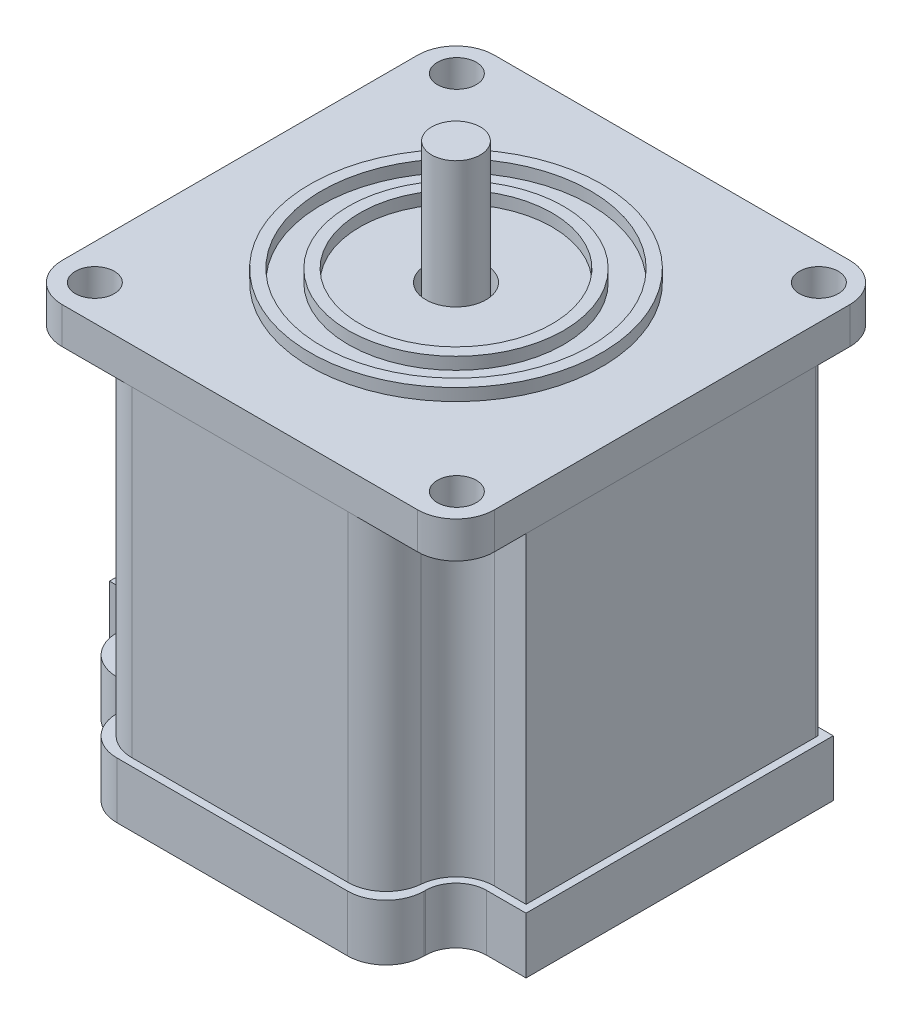
from build123d import *

# Parameters (mm, degrees)
SKETCH1_W            = 56.4
SKETCH1_H            = 56.4
BOSS_EXTRUDE1_DEPTH  = 27
SKETCH2_R            = 19.05
SKETCH2_R_2          = 17.55
SKETCH2_R_3          = 14.05
SKETCH2_R_4          = 12.55
BOSS_EXTRUDE2_DEPTH  = 1.59
CUT_EXTRUDE1_DEPTH   = 49.24
LPATTERN2_COUNT      = 2
LPATTERN2_PITCH      = 47.25
LPATTERN2_COUNT_DIR2 = 2
LPATTERN2_PITCH_DIR2 = 47.25
SKETCH5_R            = 2.5400000000000027
CUT_EXTRUDE3_DEPTH   = 11.24
LPATTERN3_COUNT      = 2
LPATTERN3_PITCH      = 47.25
LPATTERN3_COUNT_DIR2 = 2
LPATTERN3_PITCH_DIR2 = 47.25
SKETCH6_R            = 3.175
BOSS_EXTRUDE3_DEPTH  = 16
CUT_EXTRUDE4_START   = -8
SKETCH8_R            = 3.925
SKETCH8_R_2          = 3.175
CUT_EXTRUDE4_DEPTH   = 8
FILLET2_R            = 5
BOSS_EXTRUDE5_DEPTH  = 7.33
CUT_EXTRUDE7_DEPTH   = 1
BOSS_EXTRUDE6_START  = -7.33
SKETCH19_W           = 1
SKETCH19_H           = 19.399999999999995
BOSS_EXTRUDE6_DEPTH  = 7.33
FILLET3_R            = 5
FILLET4_R            = 5
FILLET5_R            = 5
FILLET6_R            = 5
FILLET7_R            = 5
FILLET8_R            = 5
FILLET10_R           = 5
FILLET11_R           = 5
FILLET12_R           = 5
FILLET13_R           = 5
FILLET14_R           = 5
FILLET15_R           = 5


with BuildPart() as part:
    # Sketch1 → Boss-Extrude1 (new, symmetric)
    with BuildSketch(Plane(origin=(0, 0, 0), x_dir=(1, 0, 0), z_dir=(0, 1, 0))):
        Rectangle(SKETCH1_W, SKETCH1_H)
    extrude(amount=BOSS_EXTRUDE1_DEPTH, both=True)

    # Sketch2 → Boss-Extrude2 (add)
    # profile 1 of 2: a face of its own
    with BuildSketch(Plane(origin=(0, 27, 0), x_dir=(1, 0, 0), z_dir=(0, 1, 0))):
        with Locations(Location((0, 0, 0), (0, 0, 90))):
            Circle(SKETCH2_R)
        with Locations(Location((0, 0, 0), (0, 0, 90))):
            Circle(SKETCH2_R_2, mode=Mode.SUBTRACT)
    # profile 2 of 2: a face of its own
    with BuildSketch(Plane(origin=(0, 27, 0), x_dir=(1, 0, 0), z_dir=(0, 1, 0))):
        with Locations(Location((0, 0, 0), (0, 0, 90))):
            Circle(SKETCH2_R_3)
        with Locations(Location((0, 0, 0), (0, 0, 90))):
            Circle(SKETCH2_R_4, mode=Mode.SUBTRACT)
    extrude(amount=BOSS_EXTRUDE2_DEPTH)

    # Sketch3 → Cut-Extrude1 (cut)
    with BuildSketch(Plane.XZ.offset(27)):
        Polygon((-28.200000000000006, 28.200000000000003), (-19.060000000000006, 28.200000000000003), (-19.060000000000013, 19.050000000000004), (-28.200000000000014, 19.050000000000004), align=None)
    cut_extrude1 = extrude(amount=-CUT_EXTRUDE1_DEPTH, mode=Mode.SUBTRACT)

    # LPattern2: Cut-Extrude1 2 × 2
    with Locations(*[(i * LPATTERN2_PITCH, 0, -j * LPATTERN2_PITCH_DIR2) for i in range(LPATTERN2_COUNT) for j in range(LPATTERN2_COUNT_DIR2) if (i, j) != (0, 0)]):
        add(cut_extrude1, mode=Mode.SUBTRACT)

    # Sketch5 → Cut-Extrude3 (cut)
    with BuildSketch(Plane(origin=(0, 27, 0), x_dir=(1, 0, 0), z_dir=(0, 1, 0))):
        with Locations(Location((-23.57, -23.57, 0), (0, 0, 270))):
            Circle(SKETCH5_R)
    cut_extrude3 = extrude(amount=-CUT_EXTRUDE3_DEPTH, mode=Mode.SUBTRACT)

    # LPattern3: Cut-Extrude3 2 × 2
    with Locations(*[(i * LPATTERN3_PITCH, 0, -j * LPATTERN3_PITCH_DIR2) for i in range(LPATTERN3_COUNT) for j in range(LPATTERN3_COUNT_DIR2) if (i, j) != (0, 0)]):
        add(cut_extrude3, mode=Mode.SUBTRACT)

    # Sketch6 → Boss-Extrude3 (add)
    with BuildSketch(Plane(origin=(0, 27, 0), x_dir=(1, 0, 0), z_dir=(0, 1, 0))):
        with Locations(Location((0, 0, 0), (0, 0, 90))):
            Circle(SKETCH6_R)
    extrude(amount=BOSS_EXTRUDE3_DEPTH)

    # Sketch8 → Cut-Extrude4 (cut)
    with BuildSketch(Plane(origin=(0, 27, 0), x_dir=(1, 0, 0), z_dir=(0, 1, 0)).offset(CUT_EXTRUDE4_START)):
        with Locations(Location((0, 0, 0), (0, 0, 270))):
            Circle(SKETCH8_R)
        with Locations(Location((0, 0, 0), (0, 0, 270))):
            Circle(SKETCH8_R_2, mode=Mode.SUBTRACT)
    extrude(amount=CUT_EXTRUDE4_DEPTH, mode=Mode.SUBTRACT)

    # Fillet2
    fillet2_edges = [part.edges().sort_by_distance(p)[0] for p in [
        (-19.060000000000013, -2.379999999999999, 19.050000000000004),
        (-19.060000000000006, -2.379999999999999, -19.049999999999997),
        (19.049999999999986, -2.379999999999999, 19.050000000000004),
        (19.049999999999994, -2.379999999999999, -19.049999999999997),
    ]]
    fillet(fillet2_edges, radius=FILLET2_R)

    # Sketch9 → Boss-Extrude5 (add)
    with BuildSketch(Plane.ZY.offset(28.200000000000006)):
        Polygon((-9.699999999999996, -27.000000000000014), (9.7, -27.00000000000001), (9.700000000000003, -19.67), (-9.699999999999996, -19.670000000000005), align=None)
    extrude(amount=BOSS_EXTRUDE5_DEPTH)

    # Sketch17 → Cut-Extrude7 (cut)
    with BuildSketch(Plane(origin=(28.199999999999992, 0, 0), x_dir=(0, 0, -1), z_dir=(1, 0, 0))):
        Polygon((-28.200000000000003, -27), (-19.060000000000002, -27), (-19.060000000000002, 22.24), (-28.200000000000017, 22.24), align=None)
        Polygon((28.199999999999996, -27), (19.059999999999988, -27), (19.05999999999999, 22.24), (28.19999999999999, 22.24), align=None)
    extrude(amount=-CUT_EXTRUDE7_DEPTH, mode=Mode.SUBTRACT)

    # Sketch19 → Boss-Extrude6 (add)
    with BuildSketch(Plane.XZ.offset(27).offset(BOSS_EXTRUDE6_START)):
        with BuildLine():
            Line((-28.200000000000006, 9.700000000000001), (-28.200000000000014, 19.050000000000004))
            Line((-28.200000000000014, 19.050000000000004), (-24.060000000000013, 19.050000000000004))
            ThreePointArc((-24.060000000000013, 19.050000000000004), (-20.524466094067275, 20.514466094067267), (-19.060000000000006, 24.05))
            Line((-19.06000000000001, 24.05), (-19.060000000000006, 28.200000000000003))
            Line((-19.060000000000006, 28.200000000000003), (19.049999999999994, 28.200000000000003))
            Line((19.049999999999994, 28.200000000000003), (19.04999999999999, 24.050000000000008))
            ThreePointArc((19.04999999999999, 24.050000000000008), (20.514466094067252, 20.51446609406727), (24.04999999999999, 19.050000000000004))
            Line((24.04999999999999, 19.050000000000004), (28.189999999999987, 19.050000000000004))
            Line((28.189999999999987, 19.050000000000004), (28.18999999999999, 19.060000000000002))
            Line((28.18999999999999, 19.060000000000002), (28.199999999999992, 19.060000000000002))
            Line((28.199999999999992, 19.060000000000002), (28.199999999999992, -19.059999999999988))
            Line((28.199999999999992, -19.059999999999988), (28.19, -19.059999999999988))
            Line((28.19, -19.059999999999988), (28.19, -19.049999999999997))
            Line((28.19, -19.049999999999997), (24.049999999999997, -19.049999999999997))
            ThreePointArc((24.049999999999997, -19.049999999999997), (20.51446609406726, -20.51446609406726), (19.049999999999997, -24.049999999999994))
            Line((19.049999999999997, -24.049999999999994), (19.049999999999994, -28.199999999999996))
            Line((19.049999999999994, -28.199999999999996), (-19.060000000000006, -28.199999999999996))
            Line((-19.060000000000006, -28.199999999999996), (-19.060000000000002, -24.05))
            ThreePointArc((-19.060000000000002, -24.05), (-20.524466094067265, -20.51446609406726), (-24.060000000000006, -19.049999999999997))
            Line((-24.060000000000006, -19.049999999999997), (-28.2, -19.049999999999997))
            Line((-28.2, -19.049999999999997), (-28.200000000000006, -9.699999999999994))
            Line((-28.200000000000006, -9.699999999999994), (-29.200000000000006, -9.699999999999994))
            Line((-29.200000000000006, -9.699999999999994), (-29.2, -20.049999999999997))
            Line((-29.2, -20.049999999999997), (-24.060000000000006, -20.049999999999997))
            ThreePointArc((-24.060000000000006, -20.049999999999997), (-21.231572875253814, -21.22157287525381), (-20.060000000000006, -24.05))
            Line((-20.060000000000006, -24.05), (-20.060000000000013, -29.199999999999996))
            Line((-20.060000000000016, -29.199999999999996), (20.049999999999997, -29.199999999999996))
            Line((20.049999999999997, -29.199999999999996), (20.049999999999997, -24.049999999999994))
            ThreePointArc((20.049999999999997, -24.049999999999994), (21.22157287525381, -21.221572875253806), (24.049999999999997, -20.049999999999997))
            Line((24.049999999999997, -20.049999999999997), (29.189999999999987, -20.049999999999997))
            Line((29.189999999999987, -20.049999999999997), (29.189999999999994, 20.050000000000004))
            Line((29.189999999999994, 20.050000000000004), (24.04999999999999, 20.050000000000004))
            ThreePointArc((24.04999999999999, 20.050000000000004), (21.2215728752538, 21.221572875253816), (20.04999999999999, 24.050000000000008))
            Line((20.04999999999999, 24.050000000000008), (20.049999999999986, 29.200000000000006))
            Line((20.049999999999986, 29.200000000000006), (-20.060000000000006, 29.200000000000003))
            Line((-20.060000000000006, 29.200000000000003), (-20.060000000000006, 24.05))
            ThreePointArc((-20.060000000000006, 24.05), (-21.23157287525382, 21.221572875253813), (-24.060000000000013, 20.050000000000004))
            Line((-24.060000000000013, 20.050000000000004), (-29.200000000000014, 20.050000000000004))
            Line((-29.200000000000014, 20.050000000000004), (-29.200000000000006, 9.700000000000001))
            Line((-29.200000000000006, 9.700000000000001), (-28.200000000000006, 9.700000000000001))
        make_face()
        with Locations((-28.700000000000006, 3.55e-15)):
            Rectangle(SKETCH19_W, SKETCH19_H)
    extrude(amount=BOSS_EXTRUDE6_DEPTH)

    # Fillet3
    fillet3_edges = [part.edges().sort_by_distance(p)[0] for p in [
        (28.199999999999992, 24.619999999999997, 28.200000000000003),
        (-28.200000000000006, 24.62, 28.200000000000003),
        (-28.200000000000006, 24.62, -28.199999999999996),
        (28.199999999999992, 24.619999999999997, -28.199999999999996),
    ]]
    fillet(fillet3_edges, radius=FILLET3_R)

    # Fillet4
    # the kernel refuses this fillet: 5 mm, written as the material it takes off along each edge
    with BuildSketch(Plane(origin=(28.189999999999987, 22.239999999999995, 19.060000000000002), x_dir=(-7.1e-16, 0, -1), z_dir=(0, -1, 0))) as fillet4_piece_1_section:
        with BuildLine():
            CenterArc((FILLET4_R, FILLET4_R), FILLET4_R, 180.00000000000003, 90)
            Line((-3.55e-15, FILLET4_R), (0, 0))
            Line((0, 0), (FILLET4_R, 0))
        make_face()
    fillet4_piece_1 = extrude(amount=41.91, mode=Mode.PRIVATE)
    fillet4_piece_1 = split(fillet4_piece_1, bisect_by=Plane(origin=(28.194999999999993, 1.2849999999999966, 19.050000000000004), z_dir=(0, 0, 1)), keep=Keep.TOP, mode=Mode.PRIVATE)
    add(fillet4_piece_1, mode=Mode.SUBTRACT)
    with BuildSketch(Plane(origin=(19.049999999999994, -19.67, 28.200000000000003), x_dir=(-1, 0, 0), z_dir=(0, 1, 0))) as fillet4_piece_2:
        with BuildLine():
            CenterArc((4.96380951243048, -5), FILLET4_R, 90, 85.12397513038704)
            Line((-0.01809524378475658, -4.574999999999999), (-0.5162857194062802, -4.532499999999999))
            ThreePointArc((-0.5162857194062802, -4.532499999999999), (-0.49999999999999645, -4.149999999999995), (-0.5, 0))
            Line((-0.5, 0), (0, 0.5))
            Line((0, 0.5), (4.96380951243048, 0.5))
            Line((4.96380951243048, 0.5), (4.96380951243048, 0))
        make_face()
    extrude(amount=41.910000000000004, mode=Mode.SUBTRACT)
    with BuildSketch(Plane(origin=(-19.060000000000006, -19.67, 28.200000000000003), x_dir=(1, 0, 0), z_dir=(0, 1, 0))) as fillet4_piece_3:
        with BuildLine():
            CenterArc((4.963809512430471, 5), FILLET4_R, 184.87602486961296, 85.12397513038707)
            Line((-0.01809524378476723, 4.574999999999999), (-0.5162857194062909, 4.532499999999999))
            ThreePointArc((-0.5162857194062909, 4.532499999999999), (-0.5000000000000036, 4.150000000000002), (-0.5, 0))
            Line((-0.5, 0), (0, -0.5))
            Line((0, -0.5), (4.963809512430471, -0.5))
            Line((4.963809512430471, -0.5), (4.963809512430471, 0))
        make_face()
    extrude(amount=41.910000000000004, mode=Mode.SUBTRACT)
    with BuildSketch(Plane(origin=(-28.200000000000014, -19.67, 19.050000000000004), x_dir=(1.43e-15, 0, -1), z_dir=(0, 1, 0))) as fillet4_piece_4:
        with BuildLine():
            CenterArc((4.962951369950581, -5), FILLET4_R, 90.00000000000009, 85.06646876992886)
            Line((-0.01852431502470665, -4.570000000000004), (-0.5166718835222361, -4.5270000000000055))
            ThreePointArc((-0.5166718835222361, -4.5270000000000055), (-0.49999999999999406, -4.1400000000000015), (-0.5, -7.2e-16))
            Line((-0.5, -7.2e-16), (-7.2e-16, 0.5))
            Line((-7.2e-16, 0.5), (4.962951369950573, 0.5))
            Line((4.962951369950573, 0.5), (4.962951369950574, 0))
        make_face()
    extrude(amount=41.910000000000004, mode=Mode.SUBTRACT)

    # Fillet5
    # the kernel refuses this fillet: 5 mm, written as the material it takes off along each edge
    with BuildSketch(Plane(origin=(19.049999999999986, -19.67, -28.199999999999996), x_dir=(0.003955213605638994, 0, 0.999992178112076), z_dir=(0, 1, 0))) as fillet5_piece_1:
        with BuildLine():
            CenterArc((4.980327963641015, -4.983546754096982), FILLET5_R, 94.64940723207758, 85.12397513038707)
            Line((-0.01963292691936526, -4.963770686068789), (-0.5196290159754032, -4.961793079265969))
            Line((-0.5196290159754032, -4.961793079265969), (-0.499996089056038, 0.0019776068028195))
            Line((-0.499996089056038, 0.0019776068028195), (0.0019776068028195, 0.499996089056038))
            ThreePointArc((0.0019776068028195, 0.499996089056038), (4.151945145967937, 0.4835819525926397), (4.534506567594776, 0.4983546754096982))
            Line((4.534506567594776, 0.4983546754096982), (4.575035785417161, 0))
        make_face()
    extrude(amount=41.910000000000004, mode=Mode.SUBTRACT)

    # Fillet6
    # the kernel refuses this fillet: 5 mm, written as the material it takes off along each edge
    with BuildSketch(Plane(origin=(28.199999999999992, -19.67, -19.059999999999988), x_dir=(-1, 0, 0), z_dir=(0, 1, -7e-17))) as fillet6_piece_1:
        with BuildLine():
            CenterArc((5, 0.3160696125855509), FILLET6_R, 180, 3.624307494007553)
            Line((0, 0.3160696125855509), (0, 0))
            Line((0, 0), (0.00999999999999801, 0))
        make_face()
    extrude(amount=41.91, mode=Mode.SUBTRACT)

    # Fillet7
    # the kernel refuses this fillet: 5 mm, written as the material it takes off along each edge
    with BuildSketch(Plane(origin=(-28.200000000000006, -19.67, -19.049999999999997), x_dir=(0.9999917848297434, 0, -0.004053427318230063), z_dir=(0, 1, 0))) as fillet7_piece_1:
        with BuildLine():
            CenterArc((4.979841961486708, -4.983177735051244), FILLET7_R, 94.70128631619599, 85.06646876992889)
            Line((-0.02011696266200852, -4.962910598460094), (-0.5201128550768802, -4.960883884800979))
            Line((-0.5201128550768802, -4.960883884800979), (-0.4999958924148717, 0.00202671365911503))
            Line((-0.4999958924148717, 0.00202671365911503), (0.00202671365911503, 0.4999958924148717))
            ThreePointArc((0.00202671365911503, 0.4999958924148717), (4.141992702854253, 0.48321470331739924), (4.5290571018514765, 0.49831777350512513))
            Line((4.5290571018514765, 0.49831777350512513), (4.570037543636496, 0))
        make_face()
    extrude(amount=41.910000000000004, mode=Mode.SUBTRACT)

    # Fillet8
    # the kernel refuses this fillet: 5 mm, written as the material it takes off along each edge
    with BuildSketch(Plane(origin=(-19.060000000000013, -19.67, -28.199999999999996), x_dir=(1, 0, 0), z_dir=(0, 1, 0))) as fillet8_piece_1:
        with BuildLine():
            CenterArc((4.96380951243048, -5), FILLET8_R, 90, 85.12397513038704)
            Line((-0.01809524378475658, -4.574999999999999), (-0.5162857194062802, -4.532499999999999))
            ThreePointArc((-0.5162857194062802, -4.532499999999999), (-0.49999999999999645, -4.149999999999995), (-0.5, 0))
            Line((-0.5, 0), (0, 0.5))
            Line((0, 0.5), (4.96380951243048, 0.5))
            Line((4.96380951243048, 0.5), (4.96380951243048, 0))
        make_face()
    extrude(amount=41.910000000000004, mode=Mode.SUBTRACT)

    # Fillet10
    fillet10_edges = [part.edges().sort_by_distance(p)[0] for p in [
        (-20.060000000000006, -23.335, 29.200000000000003),
    ]]
    fillet(fillet10_edges, radius=FILLET10_R)

    # Fillet11
    fillet11_edges = [part.edges().sort_by_distance(p)[0] for p in [
        (-29.200000000000014, -23.335, 20.050000000000004),
    ]]
    fillet(fillet11_edges, radius=FILLET11_R)

    # Fillet12
    fillet12_edges = [part.edges().sort_by_distance(p)[0] for p in [
        (-29.2, -23.335, -20.049999999999997),
    ]]
    fillet(fillet12_edges, radius=FILLET12_R)

    # Fillet13
    fillet13_edges = [part.edges().sort_by_distance(p)[0] for p in [
        (-20.060000000000016, -23.335, -29.199999999999996),
    ]]
    fillet(fillet13_edges, radius=FILLET13_R)

    # Fillet14
    fillet14_edges = [part.edges().sort_by_distance(p)[0] for p in [
        (20.049999999999997, -23.335, -29.199999999999996),
    ]]
    fillet(fillet14_edges, radius=FILLET14_R)

    # Fillet15
    fillet15_edges = [part.edges().sort_by_distance(p)[0] for p in [
        (20.049999999999986, -23.335, 29.200000000000006),
    ]]
    fillet(fillet15_edges, radius=FILLET15_R)


solid = part.part
